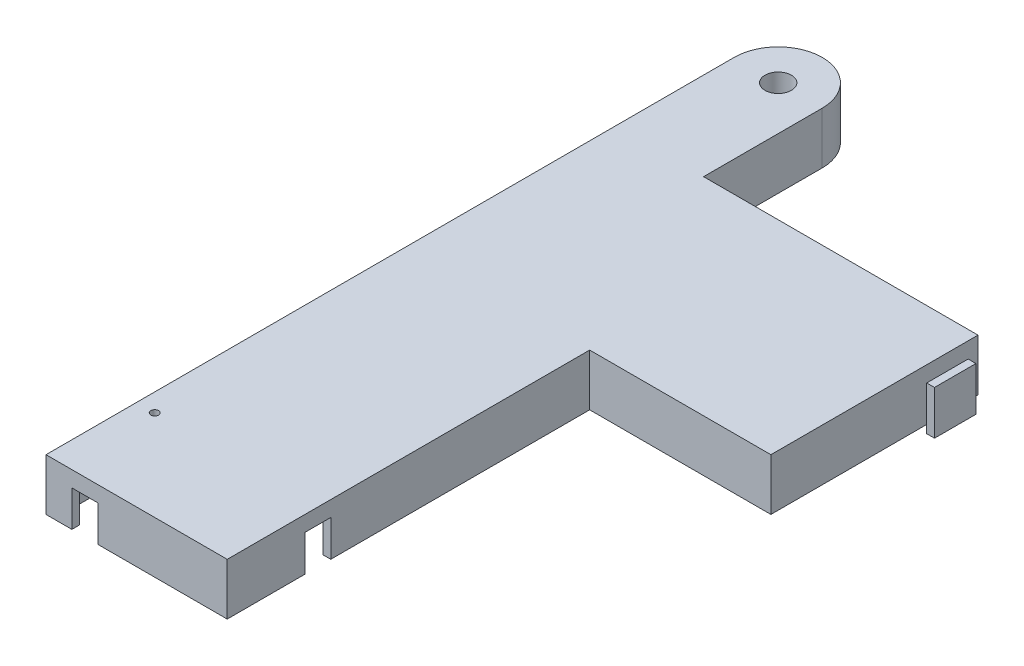
from build123d import *

# Parameters (mm, degrees)
CORNERBOSS_EXTRUDE1_DEPTH               = 20
SHELL2_T                                = -3
PADSKETCH3_R                            = 12
PADSKETCH3_R_2                          = 5
PADBOSS_EXTRUDE2_DEPTH                  = 10
STEPPERSHAFTHOLESKETCH4_R               = 5.1
STEPPERSHAFTHOLESKETCH4_R_2             = 1.5
STEPPERSHAFTCUT_EXTRUDE2_DEPTH          = 316.846451025
THREADEDNUTMOUNTHOLESSKETCH5_R          = 1
THREADEDNUTMOUNTHOLESCUT_EXTRUDE4_DEPTH = 10
TRPEGSKETCH1_W                          = 9.8
TRPEGSKETCH1_H                          = 13.9
TRPEGBOSS_EXTRUDE1_DEPTH                = 3.1
TRPEGCAPSKETCH2_W                       = 16
TRPEGCAPSKETCH2_H                       = 17
TRPEGCAPBOSS_EXTRUDE2_DEPTH             = 3
BOTTOMPEGHOLESKETCH3_W                  = 10
BOTTOMPEGHOLESKETCH3_H                  = 13.9
BOTTOMPEGHOLECUT_EXTRUDE1_DEPTH         = 3
BEDCENTERPEGHOLECUTSKETCH1_W            = 10
BEDCENTERPEGHOLECUTSKETCH1_H            = 14
BEDCENTERPEGHOLECUT_EXTRUDE1_DEPTH      = 3


with BuildPart() as part:
    # CornerrSketch1 → CornerBoss-Extrude1 (new body)
    with BuildSketch(Plane(origin=(0, 0, 0), x_dir=(1, 0, 0), z_dir=(0, 1, 0))):
        with BuildLine():
            Line((140, 220), (140, 140))
            Line((140, 140), (70, 140))
            Line((70, 140), (70, 0))
            Line((70, 0), (0, 0))
            Line((0, 0), (0, 265.825))
            ThreePointArc((0, 265.825), (17, 282.825), (34, 265.825))
            Line((34, 265.825), (34, 220))
            Line((34, 220), (140, 220))
        make_face()
    extrude(amount=CORNERBOSS_EXTRUDE1_DEPTH)

    # Shell2
    shell2_openings = [part.faces().sort_by_distance(p)[0] for p in [
        (50.460788317, 0, -139.249856422),
    ]]
    offset(amount=SHELL2_T, openings=shell2_openings, kind=Kind.INTERSECTION)

    # PadSketch3 → PadBoss-Extrude2 (add)
    with BuildSketch(Plane.XZ.offset(-17)):
        with Locations((17, -265.825)):
            Circle(PADSKETCH3_R)
        with Locations((7, -35)):
            Circle(PADSKETCH3_R_2)
    extrude(amount=PADBOSS_EXTRUDE2_DEPTH)

    # StepperShaftHoleSketch4 → StepperShaftCut-Extrude2 (cut, through all)
    with BuildSketch(Plane.XZ.offset(-7)):
        with Locations((17, -265.825)):
            Circle(STEPPERSHAFTHOLESKETCH4_R)
        with Locations((7, -35)):
            Circle(STEPPERSHAFTHOLESKETCH4_R_2)
    extrude(amount=-STEPPERSHAFTCUT_EXTRUDE2_DEPTH, mode=Mode.SUBTRACT)

    # ThreadedNutMountHolesSketch5 → ThreadedNutMountHolesCut-Extrude4 (cut)
    with BuildSketch(Plane(origin=(0, 7, 0), x_dir=(-1, 0, 0), z_dir=(0, -1, 0))):
        with Locations((-17, 273.825)):
            Circle(THREADEDNUTMOUNTHOLESSKETCH5_R)
        with Locations((-9, 265.825)):
            Circle(THREADEDNUTMOUNTHOLESSKETCH5_R)
        with Locations((-17, 257.825)):
            Circle(THREADEDNUTMOUNTHOLESSKETCH5_R)
        with Locations((-25, 265.825)):
            Circle(THREADEDNUTMOUNTHOLESSKETCH5_R)
    extrude(amount=-THREADEDNUTMOUNTHOLESCUT_EXTRUDE4_DEPTH, mode=Mode.SUBTRACT)

    # TRPegSketch1 → TRPegBoss-Extrude1 (add)
    with BuildSketch(Plane(origin=(140, 0, 0), x_dir=(0, 0, -1), z_dir=(1, 0, 0))):
        with Locations((205, 6.95)):
            Rectangle(TRPEGSKETCH1_W, TRPEGSKETCH1_H)
    extrude(amount=TRPEGBOSS_EXTRUDE1_DEPTH)

    # TRPegCapSketch2 → TRPegCapBoss-Extrude2 (add)
    with BuildSketch(Plane(origin=(143.1, 0, 0), x_dir=(0, 0, -1), z_dir=(1, 0, 0))):
        with Locations((205.1, 8.5)):
            Rectangle(TRPEGCAPSKETCH2_W, TRPEGCAPSKETCH2_H)
    extrude(amount=TRPEGCAPBOSS_EXTRUDE2_DEPTH)

    # BottomPegHoleSketch3 → BottomPegHoleCut-Extrude1 (cut)
    with BuildSketch(Plane.XY):
        with Locations((15, 6.95)):
            Rectangle(BOTTOMPEGHOLESKETCH3_W, BOTTOMPEGHOLESKETCH3_H)
    extrude(amount=-BOTTOMPEGHOLECUT_EXTRUDE1_DEPTH, mode=Mode.SUBTRACT)

    # BedCenterPegHoleCutSketch1 → BedCenterPegHoleCut-Extrude1 (cut)
    with BuildSketch(Plane(origin=(70, 0, 0), x_dir=(0, 0, -1), z_dir=(1, 0, 0))):
        with Locations((35, 7)):
            Rectangle(BEDCENTERPEGHOLECUTSKETCH1_W, BEDCENTERPEGHOLECUTSKETCH1_H)
    extrude(amount=-BEDCENTERPEGHOLECUT_EXTRUDE1_DEPTH, mode=Mode.SUBTRACT)


solid = part.part
